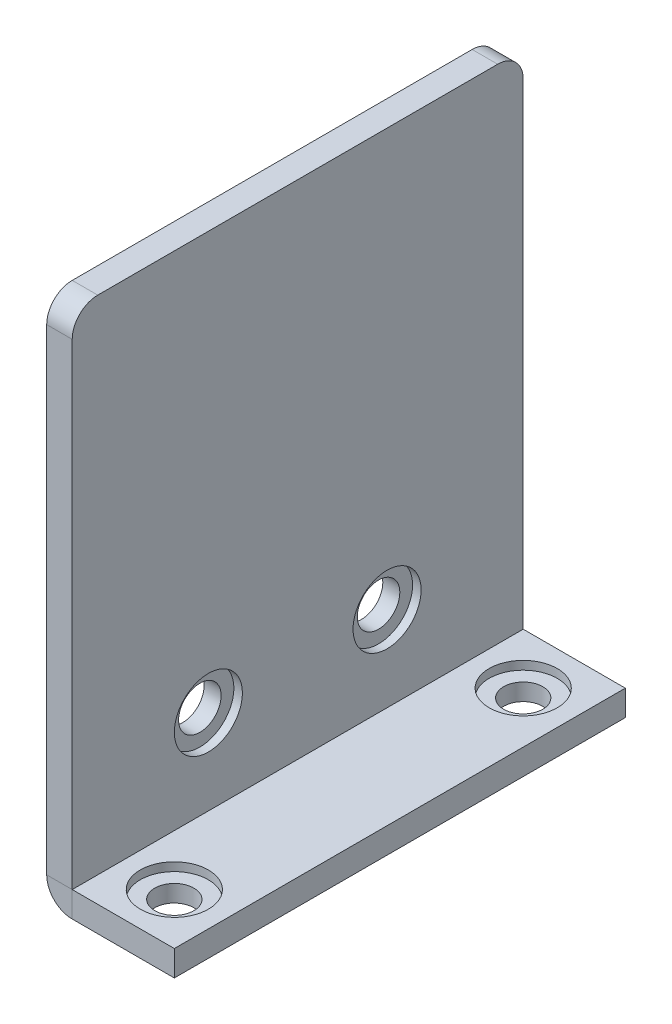
from build123d import *

# Parameters (mm, degrees)
SM_BASE_FLANGE_1_DEPTH    = 53
SKETCH_7_R                = 9
SKETCH_7_R_2              = 6
EXTRUDE_1_DEPTH           = 4
SKETCH_8_R                = 6
SKETCH_8_R_2              = 5
EXTRUDE_2_DEPTH           = 1
HOLE_WIZARD_1_D           = 4.6
HOLE_WIZARD_1_CBORE_D     = 8
HOLE_WIZARD_1_CBORE_DEPTH = 1
HOLE_WIZARD_2_D           = 5
HOLE_WIZARD_2_DEPTH       = 3
HOLE_WIZARD_2_CBORE_D     = 8
HOLE_WIZARD_2_CBORE_DEPTH = 1
HOLE_WIZARD_2_TIP         = 1.502151548
FILLET_1_R                = 3
CHAMFER_1_SIZE            = 1


# Read off the part's stored shape, not the designer's step: 基体-法兰1
with BuildPart() as part:
    # 基体-法兰1 outline → 基体-法兰1 (new body)
    with BuildSketch(Plane.XY):
        with BuildLine():
            Line((3, 3), (3, 62))
            Line((3, 62), (0, 62))
            Line((0, 62), (0, 3))
            ThreePointArc((0, 3), (0.878679656, 0.878679656), (3, 0))
            Line((3, 0), (15, 0))
            Line((15, 0), (15, 3))
            Line((15, 3), (3, 3))
        make_face()
    extrude(amount=SM_BASE_FLANGE_1_DEPTH)

    # 草图7 → 凸台-拉伸1 (add)
    with BuildSketch(Plane.ZY):
        with Locations((26.5, 35)):
            Circle(SKETCH_7_R)
        with Locations((26.5, 35)):
            Circle(SKETCH_7_R_2, mode=Mode.SUBTRACT)
    extrude(amount=EXTRUDE_1_DEPTH)

    # 草图8 → 凸台-拉伸2 (add)
    with BuildSketch(Plane.ZY):
        with Locations((26.5, 35)):
            Circle(SKETCH_8_R)
        with Locations((26.5, 35)):
            Circle(SKETCH_8_R_2, mode=Mode.SUBTRACT)
    extrude(amount=EXTRUDE_2_DEPTH)

    # 打孔尺寸(%根据)内六角圆柱头螺钉的类型1 (through all)
    with Locations(Plane(origin=(0, 3, 0), x_dir=(1, 0, 0), z_dir=(0, 1, 0))):
        with Locations((9, -6), (9, -47)):
            CounterBoreHole(HOLE_WIZARD_1_D / 2, HOLE_WIZARD_1_CBORE_D / 2, HOLE_WIZARD_1_CBORE_DEPTH)

    # 打孔尺寸(%根据)内六角圆柱头螺钉的类型2
    with Locations(Plane(origin=(3, 0, 0), x_dir=(0, 0, -1), z_dir=(1, 0, 0))):
        with Locations((-37, 13), (-16, 13)):
            CounterBoreHole(HOLE_WIZARD_2_D / 2, HOLE_WIZARD_2_CBORE_D / 2, HOLE_WIZARD_2_CBORE_DEPTH, depth=HOLE_WIZARD_2_DEPTH)
            with Locations((0, 0, -(HOLE_WIZARD_2_DEPTH + HOLE_WIZARD_2_TIP / 2))):  # 118° drill point
                Cone(0, HOLE_WIZARD_2_D / 2, HOLE_WIZARD_2_TIP, mode=Mode.SUBTRACT)

    # 圆角1
    fillet_1_edges = [part.edges().sort_by_distance(p)[0] for p in [
        (1.5, 62, 0),
        (1.5, 62, 53),
    ]]
    fillet(fillet_1_edges, radius=FILLET_1_R)

    # 倒角1
    chamfer_1_edges = [part.edges().sort_by_distance(p)[0] for p in [
        (-4, 35, 20.5),
    ]]
    chamfer(chamfer_1_edges, length=CHAMFER_1_SIZE)


solid = part.part
